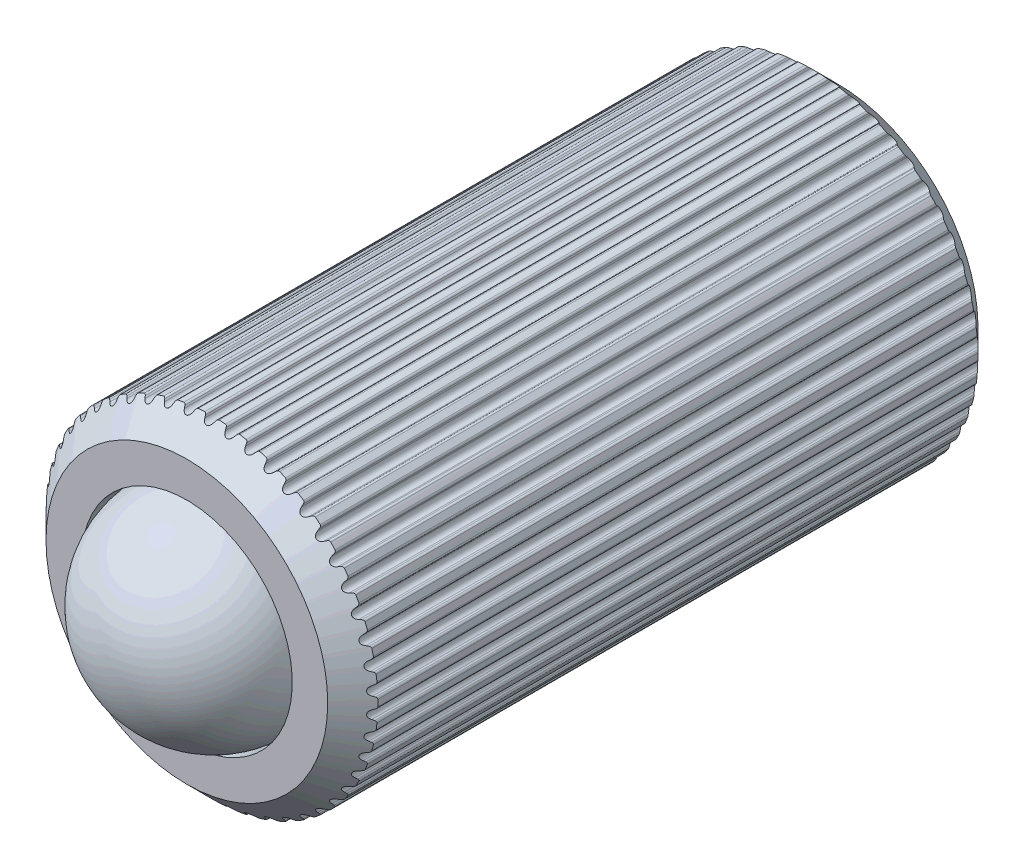
from build123d import *

# Parameters (mm, degrees)
CUT_EXTRUDE1_DEPTH       = 6.288570347
FILLET1_R                = 0.0254
CIRPATTERN1_COUNT        = 50
FILLET1_OF_CIRPATTERN1_R = 0.0254


with BuildPart() as part:
    # Sketch2 → Revolve1 (revolve)
    with BuildSketch(Plane(origin=(0, 0, 0), x_dir=(0, 0, -1), z_dir=(1, 0, 0))):
        with BuildLine():
            Line((-3.683, 1.1938), (-3.683, 1.595532339))
            Line((-3.683, 1.595532339), (-3.398932339, 1.8796))
            Line((-3.398932339, 1.8796), (3.398932339, 1.8796))
            Line((3.398932339, 1.8796), (3.683, 1.595532339))
            Line((3.683, 1.595532339), (3.683, 0))
            Line((3.683, 0), (-1.2954, 0))
            ThreePointArc((-1.2954, 0), (-1.645055925, 0.844144075), (-2.4892, 1.1938))
            Line((-2.4892, 1.1938), (-3.683, 1.1938))
        make_face()
    revolve(axis=Axis((0, 0, -3.683), (0, 0, 1)))

    # Sketch6 → Cut-Extrude1 (cut, symmetric)
    with BuildSketch(Plane.XY):
        with BuildLine():
            Line((-0.049070214, 1.847679392), (-0.066813761, 1.878412117))
            Line((-0.066813761, 1.878412117), (-0.09407821, 1.926028639))
            Line((-0.09407821, 1.926028639), (0.094305173, 1.926028639))
            Line((0.094305173, 1.926028639), (0.049070214, 1.847679392))
            ThreePointArc((0.049070214, 1.847679392), (0, 1.816946667), (-0.049070214, 1.847679392))
        make_face()
    cut_extrude1 = extrude(amount=CUT_EXTRUDE1_DEPTH, both=True, mode=Mode.SUBTRACT)

    # Fillet1
    fillet1_edges = [part.edges().sort_by_distance(p)[0] for p in [
        (0.066813761, 1.878412117, 0),
        (-0.066813761, 1.878412117, 0),
    ]]
    fillet(fillet1_edges, radius=FILLET1_R)

    # CirPattern1: Cut-Extrude1 ×50 about axis
    cirpattern1_axis = Axis((0, 0, -3.683), (0, 0, 1))
    for i in range(1, CIRPATTERN1_COUNT):
        add(cut_extrude1.rotate(cirpattern1_axis, i * 360 / CIRPATTERN1_COUNT), mode=Mode.SUBTRACT)

    # Fillet1 of CirPattern1
    fillet1_of_cirpattern1_edges = [part.edges().sort_by_distance(p)[0] for p in [
        (-0.16914055, 1.871974261, 0),
        (-0.301714379, 1.855226292, 0),
        (-0.402427414, 1.836014253, 0),
        (-0.531856781, 1.80278244, 0),
        (-0.629367756, 1.771099203, 0),
        (-0.753611484, 1.721907631, 0),
        (-0.846382594, 1.678252861, 0),
        (-0.963481284, 1.613877311, 0),
        (-1.050049472, 1.558939468, 0),
        (-1.158156408, 1.480395182, 0),
        (-1.237156443, 1.415040669, 0),
        (-1.334566714, 1.323566336, 0),
        (-1.404752717, 1.248825834, 0),
        (-1.489930106, 1.145864058, 0),
        (-1.550195203, 1.062916269, 0),
        (-1.621796409, 0.95009082, 0),
        (-1.671190183, 0.860243879, 0),
        (-1.728086015, 0.739334082, 0),
        (-1.765829497, 0.644004929, 0),
        (-1.807122672, 0.516917604, 0),
        (-1.832620624, 0.417609637, 0),
        (-1.857659925, 0.286349026, 0),
        (-1.870510229, 0.184628392, 0),
        (-1.878900771, 0.051264553, 0),
        (-1.878900771, -0.051264553, 0),
        (-1.870510229, -0.184628392, 0),
        (-1.857659925, -0.286349026, 0),
        (-1.832620624, -0.417609637, 0),
        (-1.807122672, -0.516917604, 0),
        (-1.765829497, -0.644004929, 0),
        (-1.728086015, -0.739334082, 0),
        (-1.671190183, -0.860243879, 0),
        (-1.621796409, -0.95009082, 0),
        (-1.550195203, -1.062916269, 0),
        (-1.489930106, -1.145864058, 0),
        (-1.404752717, -1.248825834, 0),
        (-1.334566714, -1.323566336, 0),
        (-1.237156443, -1.415040669, 0),
        (-1.158156408, -1.480395182, 0),
        (-1.050049472, -1.558939468, 0),
        (-0.963481284, -1.613877311, 0),
        (-0.846382594, -1.678252861, 0),
        (-0.753611484, -1.721907631, 0),
        (-0.629367756, -1.771099203, 0),
        (-0.531856781, -1.80278244, 0),
        (-0.402427414, -1.836014253, 0),
        (-0.301714379, -1.855226292, 0),
        (-0.16914055, -1.871974261, 0),
        (-0.066813761, -1.878412117, 0),
        (0.066813761, -1.878412117, 0),
        (0.16914055, -1.871974261, 0),
        (0.301714379, -1.855226292, 0),
        (0.402427414, -1.836014253, 0),
        (0.531856781, -1.80278244, 0),
        (0.629367756, -1.771099203, 0),
        (0.753611484, -1.721907631, 0),
        (0.846382594, -1.678252861, 0),
        (0.963481284, -1.613877311, 0),
        (1.050049472, -1.558939468, 0),
        (1.158156408, -1.480395182, 0),
        (1.237156443, -1.415040669, 0),
        (1.334566714, -1.323566336, 0),
        (1.404752717, -1.248825834, 0),
        (1.489930106, -1.145864058, 0),
        (1.550195203, -1.062916269, 0),
        (1.621796409, -0.95009082, 0),
        (1.671190183, -0.860243879, 0),
        (1.728086015, -0.739334082, 0),
        (1.765829497, -0.644004929, 0),
        (1.807122672, -0.516917604, 0),
        (1.832620624, -0.417609637, 0),
        (1.857659925, -0.286349026, 0),
        (1.870510229, -0.184628392, 0),
        (1.878900771, -0.051264553, 0),
        (1.878900771, 0.051264553, 0),
        (1.870510229, 0.184628392, 0),
        (1.857659925, 0.286349026, 0),
        (1.832620624, 0.417609637, 0),
        (1.807122672, 0.516917604, 0),
        (1.765829497, 0.644004929, 0),
        (1.728086015, 0.739334082, 0),
        (1.671190183, 0.860243879, 0),
        (1.621796409, 0.95009082, 0),
        (1.550195203, 1.062916269, 0),
        (1.489930106, 1.145864058, 0),
        (1.404752717, 1.248825834, 0),
        (1.334566714, 1.323566336, 0),
        (1.237156443, 1.415040669, 0),
        (1.158156408, 1.480395182, 0),
        (1.050049472, 1.558939468, 0),
        (0.963481284, 1.613877311, 0),
        (0.846382594, 1.678252861, 0),
        (0.753611484, 1.721907631, 0),
        (0.629367756, 1.771099203, 0),
        (0.531856781, 1.80278244, 0),
        (0.402427414, 1.836014253, 0),
        (0.301714379, 1.855226292, 0),
        (0.16914055, 1.871974261, 0),
    ]]
    fillet(fillet1_of_cirpattern1_edges, radius=FILLET1_OF_CIRPATTERN1_R)


with BuildPart() as body_2:
    # Sketch3 → Revolve2 (revolve)
    with BuildSketch(Plane(origin=(0, 0, 0), x_dir=(0, 0, -1), z_dir=(1, 0, 0))):
        with BuildLine():
            Line((-2.1844, 0), (-4.572, 0))
            ThreePointArc((-4.572, 0), (-3.3782, 1.1938), (-2.1844, 0))
        make_face()
    revolve(axis=Axis((0, 0, -3.683), (0, 0, 1)))


solid = Compound([part.part, body_2.part])
